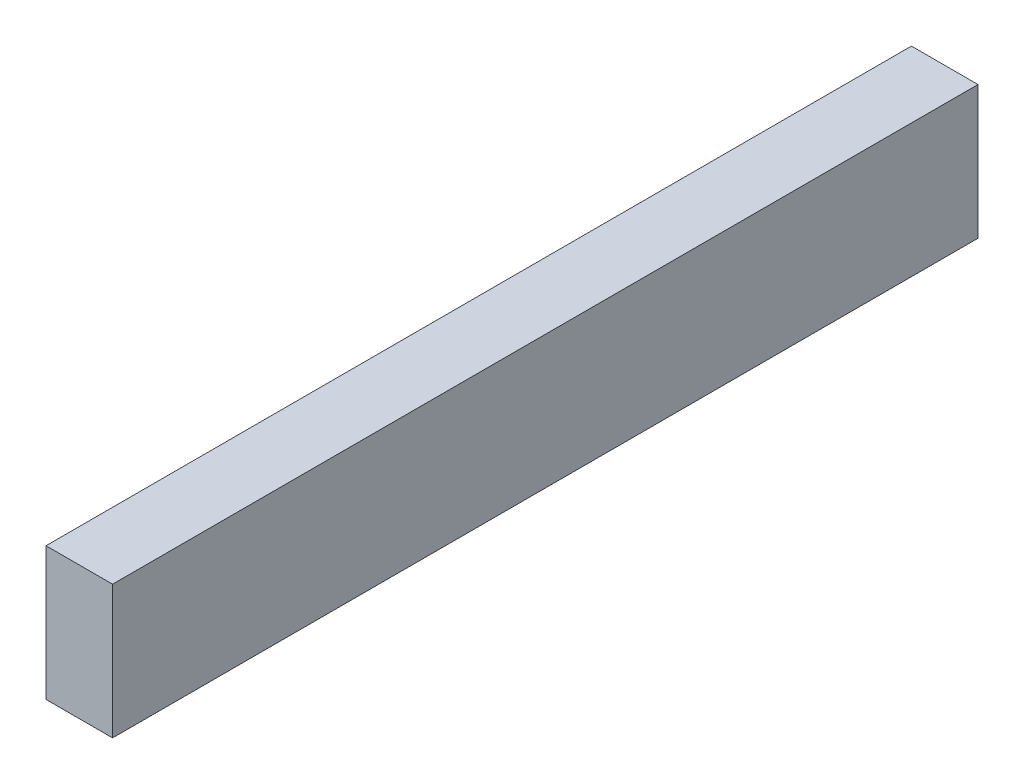
from build123d import *

# Parameters (mm, degrees)
SKETCH1_W           = 40
SKETCH1_H           = 80
BOSS_EXTRUDE1_DEPTH = 520


with BuildPart() as part:
    # Sketch1 → Boss-Extrude1 (new body)
    with BuildSketch(Plane.XY):
        with Locations((20, -40)):
            Rectangle(SKETCH1_W, SKETCH1_H)
    extrude(amount=BOSS_EXTRUDE1_DEPTH)


solid = part.part
